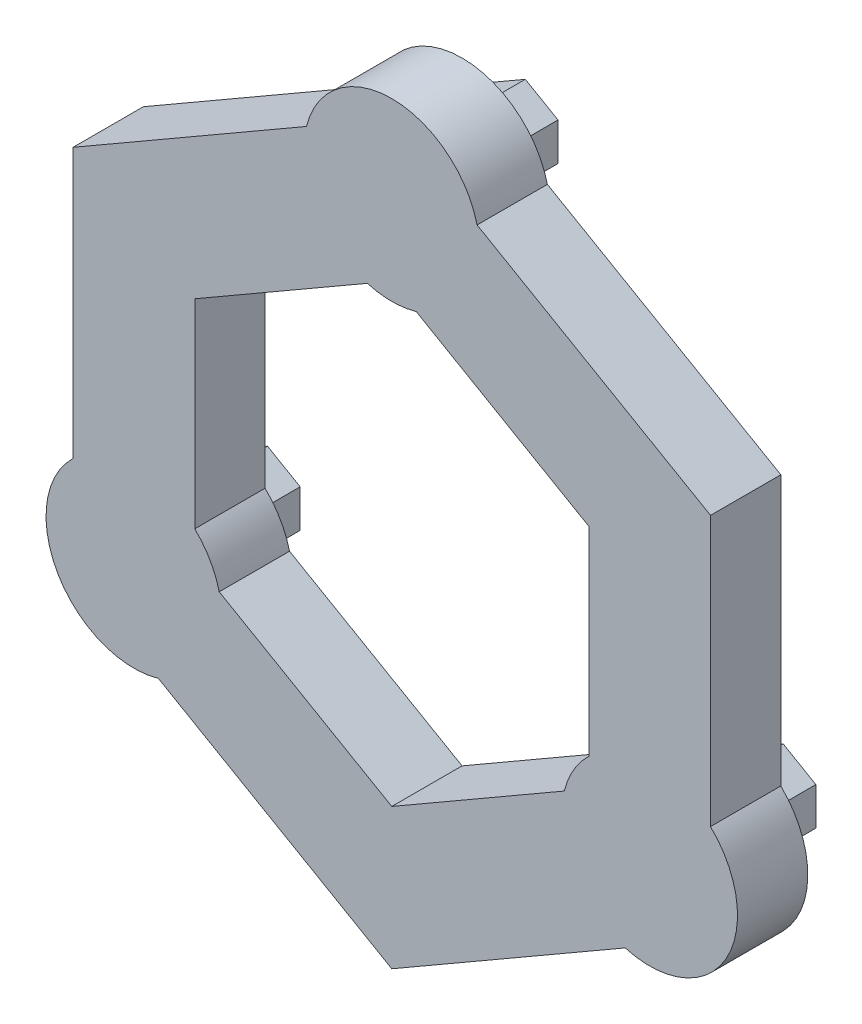
from build123d import *

# Parameters (mm, degrees)
BOSS_EXTRUDE2_DEPTH = 5
BOSS_EXTRUDE3_DEPTH = 9


with BuildPart() as part:
    # Sketch3 → Boss-Extrude2 (new, symmetric)
    with BuildSketch(Plane.XY):
        with BuildLine():
            Line((45.342492066, 26.1785), (12.136374517, 45.350060906))
            ThreePointArc((12.136374517, 45.350060906), (0, 54.857), (-12.136374517, 45.350060906))
            Line((-12.136374517, 45.350060906), (-45.342492066, 26.1785))
            Line((-45.342492066, 26.1785), (-45.342492066, -12.164621811))
            ThreePointArc((-45.342492066, -12.164621811), (-47.507555575, -27.4285), (-33.206117549, -33.185439094))
            Line((-33.206117549, -33.185439094), (0, -52.357))
            Line((0, -52.357), (33.206117549, -33.185439094))
            ThreePointArc((33.206117549, -33.185439094), (47.507555575, -27.4285), (45.342492066, -12.164621811))
            Line((45.342492066, -12.164621811), (45.342492066, 26.1785))
        make_face()
        with BuildLine():
            ThreePointArc((-3.476120479, 30.350060906), (0, 29.857), (3.476120479, 30.350060906))
            Line((3.476120479, 30.350060906), (28.02198399, 16.1785))
            Line((28.02198399, 16.1785), (28.02198399, -12.164621811))
            ThreePointArc((28.02198399, -12.164621811), (25.856920481, -14.9285), (24.545863511, -18.185439094))
            Line((24.545863511, -18.185439094), (0, -32.357))
            Line((0, -32.357), (-24.545863511, -18.185439094))
            ThreePointArc((-24.545863511, -18.185439094), (-25.856920481, -14.9285), (-28.02198399, -12.164621811))
            Line((-28.02198399, -12.164621811), (-28.02198399, 16.1785))
            Line((-28.02198399, 16.1785), (-3.476120479, 30.350060906))
        make_face(mode=Mode.SUBTRACT)
    extrude(amount=BOSS_EXTRUDE2_DEPTH, both=True)

    # Sketch4 → Boss-Extrude3 (add)
    with BuildSketch(Plane(origin=(0, 0, -5), x_dir=(-1, 0, 0), z_dir=(0, 0, -1))):
        Polygon((-41.332238028, -23.863178752), (-36.682238028, -26.547857503), (-32.032238028, -23.863178752), (-32.032238028, -18.493821248), (-36.682238028, -15.809142497), (-41.332238028, -18.493821248), align=None)
        Polygon((41.332238028, -23.863178752), (41.332238028, -18.493821248), (36.682238028, -15.809142497), (32.032238028, -18.493821248), (32.032238028, -23.863178752), (36.682238028, -26.547857503), align=None)
        Polygon((0, 47.726357503), (-4.65, 45.041678752), (-4.65, 39.672321248), (0, 36.987642497), (4.65, 39.672321248), (4.65, 45.041678752), align=None)
    extrude(amount=BOSS_EXTRUDE3_DEPTH)


solid = part.part
